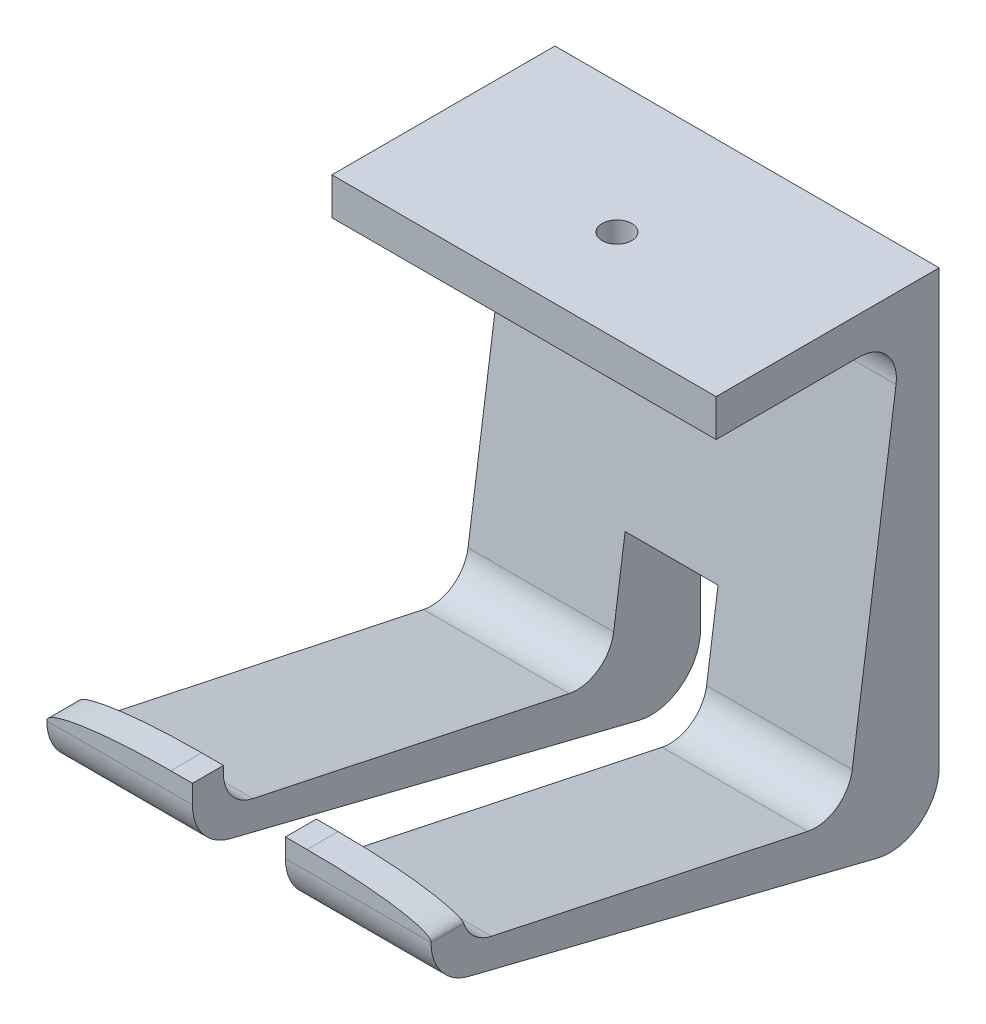
from build123d import *

# Parameters (mm, degrees)
BOSS_EXTRUDE1_DEPTH                                 = 31
FILLET1_SIZE                                        = 20
FILLET1_SIZE_2                                      = 3
FILLET2_SIZE                                        = 3
FILLET2_SIZE_2                                      = 20
CUT_EXTRUDE1_DEPTH                                  = 91.700411417
CUT_EXTRUDE1_DEPTH_BACK                             = 91.700411417
SKETCH2_W                                           = 15
SKETCH2_H                                           = 30
CSK_FOR_M4_COUNTERSUNK_FLAT_HEAD_SCREW1_D           = 4.8
CSK_FOR_M4_COUNTERSUNK_FLAT_HEAD_SCREW1_DEPTH       = 15.2
CSK_FOR_M4_COUNTERSUNK_FLAT_HEAD_SCREW1_CSINK_D     = 9.4
CSK_FOR_M4_COUNTERSUNK_FLAT_HEAD_SCREW1_CSINK_ANGLE = 90
CSK_FOR_M4_COUNTERSUNK_FLAT_HEAD_SCREW1_TIP         = 1.442065486


with BuildPart() as part:
    # Sketch1 → Boss-Extrude1 (new, symmetric)
    with BuildSketch(Plane(origin=(0, 0, 0), x_dir=(0, 0, -1), z_dir=(1, 0, 0))):
        with BuildLine():
            Line((0, 0), (23.097789557, 0))
            ThreePointArc((23.097789557, 0), (27.626047038, -2.063645826), (29.039397969, -6.835038606))
            Line((29.039397969, -6.835038606), (21.973887052, -57.10876106))
            ThreePointArc((21.973887052, -57.10876106), (19.473737257, -61.18863472), (14.784808494, -62.142608059))
            Line((14.784808494, -62.142608059), (-36.247470145, -51.295362377))
            ThreePointArc((-36.247470145, -51.295362377), (-39.662875769, -49.202399119), (-41, -45.426476772))
            Line((-41, -45.426476772), (-41, -44.285180972))
            Line((-41, -44.285180972), (-46, -44.285180972))
            Line((-46, -44.285180972), (-46, -47.304818755))
            ThreePointArc((-46, -47.304818755), (-44.304086029, -52.230110557), (-39.935375165, -55.067184565))
            Line((-39.935375165, -55.067184565), (26.064624835, -71.522832753))
            ThreePointArc((26.064624835, -71.522832753), (32.925291803, -70.064552971), (36, -63.760466942))
            Line((36, -63.760466942), (36, 6))
            Line((36, 6), (0, 6))
            Line((0, 6), (0, 0))
        make_face()
    extrude(amount=BOSS_EXTRUDE1_DEPTH, both=True)

    # Fillet1
    # an asymmetric fillet: 20, 3 mm, written as the material it takes off along each edge
    with BuildSketch(Plane(origin=(-31, -44.285180972, -9), x_dir=(1, 0, 0), z_dir=(0, 0, 1))) as fillet1_piece_1:
        with BuildLine():
            Bezier((FILLET1_SIZE, 0), (0, 0), (0, -FILLET1_SIZE_2), weights=[1, 0.707106781, 1])
            Line((0, -FILLET1_SIZE_2), (0, 0))
            Line((0, 0), (FILLET1_SIZE, 0))
        make_face()
    extrude(amount=105, mode=Mode.SUBTRACT)

    # Fillet2
    # an asymmetric fillet: 20, 3 mm, written as the material it takes off along each edge
    with BuildSketch(Plane(origin=(31, -44.285180972, -9), x_dir=(0, -1, 0), z_dir=(0, 0, 1))) as fillet2_piece_1:
        with BuildLine():
            Bezier((FILLET2_SIZE, 0), (0, 0), (0, -FILLET2_SIZE_2), weights=[1, 0.707106781, 1])
            Line((0, -FILLET2_SIZE_2), (0, 0))
            Line((0, 0), (FILLET2_SIZE, 0))
        make_face()
    extrude(amount=105, mode=Mode.SUBTRACT)

    # Sketch2 → Cut-Extrude1 (cut, two sides: drawn at the far end of the back side and taken through both)
    with BuildSketch(Plane.XY.offset(-CUT_EXTRUDE1_DEPTH_BACK)):
        with Locations((0, -59)):
            Rectangle(SKETCH2_W, SKETCH2_H)
    extrude(amount=CUT_EXTRUDE1_DEPTH + CUT_EXTRUDE1_DEPTH_BACK, mode=Mode.SUBTRACT)

    # CSK for M4 Countersunk Flat Head Screw1
    with Locations(Plane(origin=(0, 0, -15), x_dir=(0, 0, -1), z_dir=(0, -1, 0))):
        with Locations((0, 0)):
            CounterSinkHole(CSK_FOR_M4_COUNTERSUNK_FLAT_HEAD_SCREW1_D / 2, CSK_FOR_M4_COUNTERSUNK_FLAT_HEAD_SCREW1_CSINK_D / 2, depth=CSK_FOR_M4_COUNTERSUNK_FLAT_HEAD_SCREW1_DEPTH, counter_sink_angle=CSK_FOR_M4_COUNTERSUNK_FLAT_HEAD_SCREW1_CSINK_ANGLE)
            with Locations((0, 0, -(CSK_FOR_M4_COUNTERSUNK_FLAT_HEAD_SCREW1_DEPTH + CSK_FOR_M4_COUNTERSUNK_FLAT_HEAD_SCREW1_TIP / 2))):  # 118° drill point
                Cone(0, CSK_FOR_M4_COUNTERSUNK_FLAT_HEAD_SCREW1_D / 2, CSK_FOR_M4_COUNTERSUNK_FLAT_HEAD_SCREW1_TIP, mode=Mode.SUBTRACT)


solid = part.part
